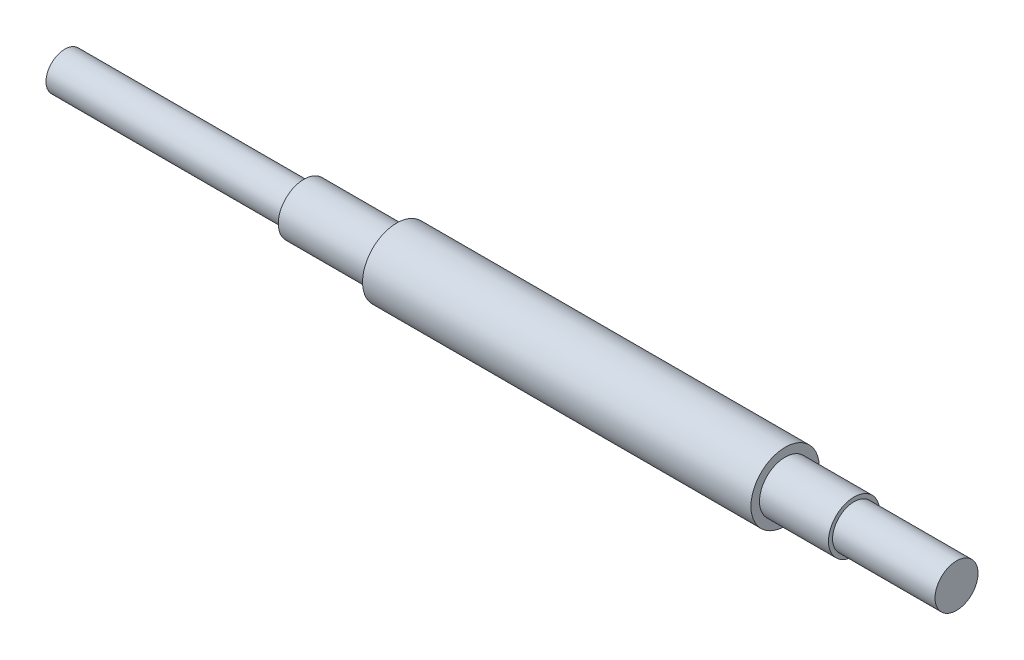
from build123d import *


with BuildPart() as part:
    # Sketch1 → Revolve1 (revolve)
    with BuildSketch(Plane(origin=(0, 0, 0), x_dir=(1, 0, 0), z_dir=(0, 1, 0))):
        Polygon((-78.63058905, 0), (-78.63058905, 3.499993), (-34.18058905, 3.499993), (-34.18058905, 4.7625), (-16.92514985, 4.7625), (-16.92514985, 6.35), (55.29481015, 6.35), (55.29481015, 4.7625), (68.11617135, 4.7625), (68.11617135, 3.99923), (87.16617135, 3.99923), (87.16617135, 0), align=None)
    revolve(axis=Axis((-97.950567047, 0, 0), (1, 0, 0)))


solid = part.part
